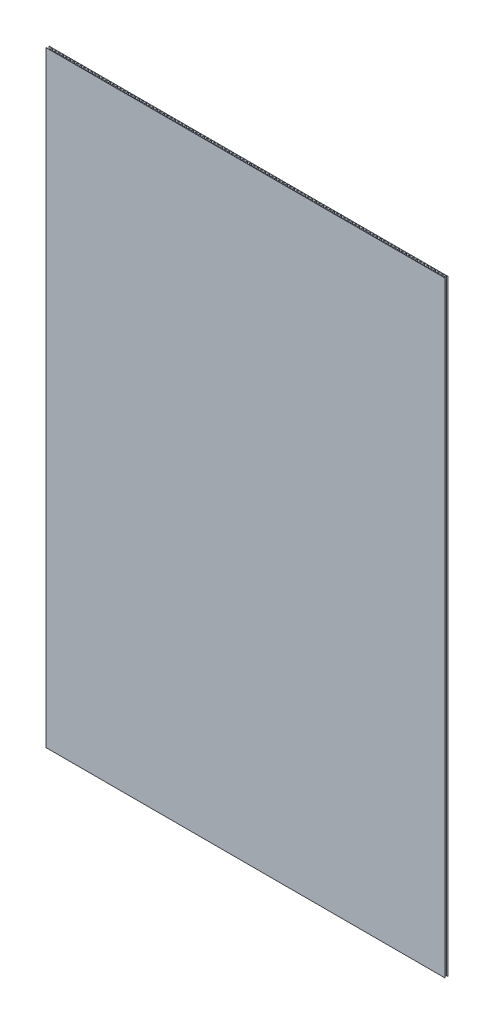
from build123d import *

# Parameters (mm, degrees)
BOSS_EXTRUDE1_DEPTH = 1678
LPATTERN1_COUNT     = 111
LPATTERN1_PITCH     = 10
SKETCH2_W           = 6
SKETCH2_H           = 1678
CUT_EXTRUDE1_DEPTH  = 2010.172217606


with BuildPart() as part:
    # Sketch1 → Boss-Extrude1 (new body)
    with BuildSketch(Plane(origin=(0, 0, 0), x_dir=(1, 0, 0), z_dir=(0, 1, 0))):
        Polygon((5, -4), (-5.3, -4), (-5.3, -3.7), (4.7, -3.7), (4.7, 3.7), (-5.3, 3.7), (-5.3, 4), (5, 4), align=None)
    boss_extrude1 = extrude(amount=BOSS_EXTRUDE1_DEPTH)

    # LPattern1: Boss-Extrude1 ×111
    with Locations(*[(i * LPATTERN1_PITCH, 0, 0) for i in range(1, LPATTERN1_COUNT)]):
        add(boss_extrude1)

    # Sketch2 → Cut-Extrude1 (cut, through all)
    with BuildSketch(Plane.XY.offset(4)):
        with Locations((1102, 839)):
            Rectangle(SKETCH2_W, SKETCH2_H)
    extrude(amount=-CUT_EXTRUDE1_DEPTH, mode=Mode.SUBTRACT)


solid = part.part
